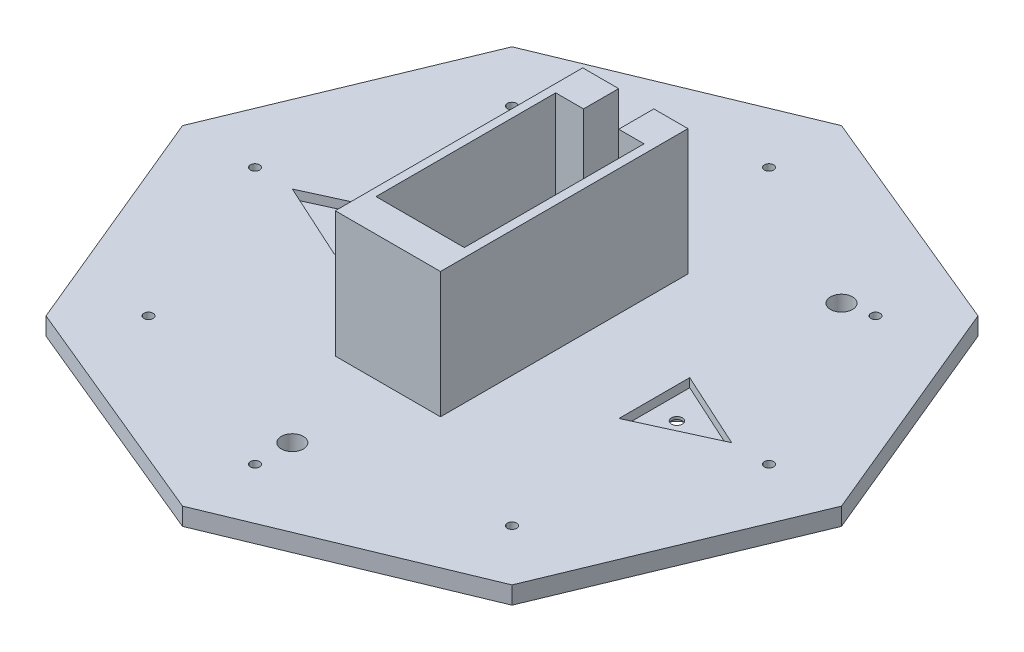
from build123d import *

# Parameters (mm, degrees)
AUFSATZ_LINEAR_AUSTRAGEN1_DEPTH      = 3
AUFSATZ_LINEAR_AUSTRAGEN1_DEPTH_BACK = 1
AUFSATZ_LINEAR_AUSTRAGEN3_DEPTH      = 31.65
SKIZZE7_R                            = 2.5
SCHNITT_LINEAR_AUSTRAGEN2_DEPTH      = 110.867294952
SCHNITT_LINEAR_AUSTRAGEN6_DEPTH      = 2
SKIZZE10_R                           = 1.25
SCHNITT_LINEAR_AUSTRAGEN7_DEPTH      = 111.405717696
SKIZZE11_R                           = 2.75
SCHNITT_LINEAR_AUSTRAGEN8_DEPTH      = 1.4
SKIZZE14_R                           = 1.05
SCHNITT_LINEAR_AUSTRAGEN9_DEPTH      = 10


with BuildPart() as part:
    # Skizze2 → Aufsatz-Linear austragen1 (new, two sides: drawn at the far end of the back side and taken through both)
    with BuildSketch(Plane(origin=(0, 0, 0), x_dir=(1, 0, 0), z_dir=(0, 1, 0)).offset(-AUFSATZ_LINEAR_AUSTRAGEN1_DEPTH_BACK)):
        Polygon((-53.033008589, 53.033008589), (-75, 0), (-53.033008589, -53.033008589), (0, -75), (53.033008589, -53.033008589), (75, 0), (53.033008589, 53.033008589), (0, 75), align=None)
    extrude(amount=AUFSATZ_LINEAR_AUSTRAGEN1_DEPTH + AUFSATZ_LINEAR_AUSTRAGEN1_DEPTH_BACK)

    # Skizze5 → Aufsatz-Linear austragen3 (add)
    with BuildSketch(Plane(origin=(0, 0, 0), x_dir=(1, 0, 0), z_dir=(0, 1, 0))):
        Polygon((-4, 28.282593288), (-4, 20.282593288), (-10.335850601, 20.282593288), (-10.335850601, -20.617406712), (9.764149399, -20.617406712), (9.764149399, 20.282593288), (4, 20.282593288), (4, 28.282593288), (11.764149399, 28.282593288), (11.764149399, -28.042881582), (-12.185850601, -28.042881582), (-12.185850601, 28.282593288), align=None)
    extrude(amount=AUFSATZ_LINEAR_AUSTRAGEN3_DEPTH)

    # Skizze7 → Schnitt-Linear austragen2 (cut, through all)
    with BuildSketch(Plane(origin=(0, 3, 0), x_dir=(1, 0, 0), z_dir=(0, 1, 0))):
        with Locations((35, 40)):
            Circle(SKIZZE7_R)
        with Locations((-35, 40)):
            Circle(SKIZZE7_R)
        with Locations((0, -50)):
            Circle(SKIZZE7_R)
    extrude(amount=-SCHNITT_LINEAR_AUSTRAGEN2_DEPTH, mode=Mode.SUBTRACT)

    # Skizze8 → Schnitt-Linear austragen6 (cut)
    with BuildSketch(Plane(origin=(0, 3, 0), x_dir=(1, 0, 0), z_dir=(0, 1, 0))):
        Polygon((-32.4, -8.05), (-32.4, 8.05), (-50, 0), align=None)
        Polygon((50, 0), (32.4, 8.05), (32.4, -8.05), align=None)
    extrude(amount=-SCHNITT_LINEAR_AUSTRAGEN6_DEPTH, mode=Mode.SUBTRACT)

    # Skizze10 → Schnitt-Linear austragen7 (cut, through all)
    with BuildSketch(Plane(origin=(0, 1, 0), x_dir=(1, 0, 0), z_dir=(0, 1, 0))):
        with Locations((-37.487800905, 0)):
            Circle(SKIZZE10_R)
        with Locations((37.49, 0.05)):
            Circle(SKIZZE10_R)
    extrude(amount=-SCHNITT_LINEAR_AUSTRAGEN7_DEPTH, mode=Mode.SUBTRACT)

    # Skizze11 → Schnitt-Linear austragen8 (cut)
    with BuildSketch(Plane.XZ.offset(1)):
        with Locations((-37.487800905, 0)):
            Circle(SKIZZE11_R)
        with Locations((37.49, -0.05)):
            Circle(SKIZZE11_R)
    extrude(amount=-SCHNITT_LINEAR_AUSTRAGEN8_DEPTH, mode=Mode.SUBTRACT)

    # Skizze14 → Schnitt-Linear austragen9 (cut)
    with BuildSketch(Plane(origin=(0, 3, 0), x_dir=(1, 0, 0), z_dir=(0, 1, 0))):
        with Locations((-58.5, 0)):
            Circle(SKIZZE14_R)
        with Locations((0, 58.5)):
            Circle(SKIZZE14_R)
        with Locations((-41.365746699, 41.365746699)):
            Circle(SKIZZE14_R)
        with Locations((41.365746699, 41.365746699)):
            Circle(SKIZZE14_R)
        with Locations((58.5, 0)):
            Circle(SKIZZE14_R)
        with Locations((41.365746699, -41.365746699)):
            Circle(SKIZZE14_R)
        with Locations((-41.365746699, -41.365746699)):
            Circle(SKIZZE14_R)
        with Locations((0, -58.5)):
            Circle(SKIZZE14_R)
    extrude(amount=-SCHNITT_LINEAR_AUSTRAGEN9_DEPTH, mode=Mode.SUBTRACT)


solid = part.part
